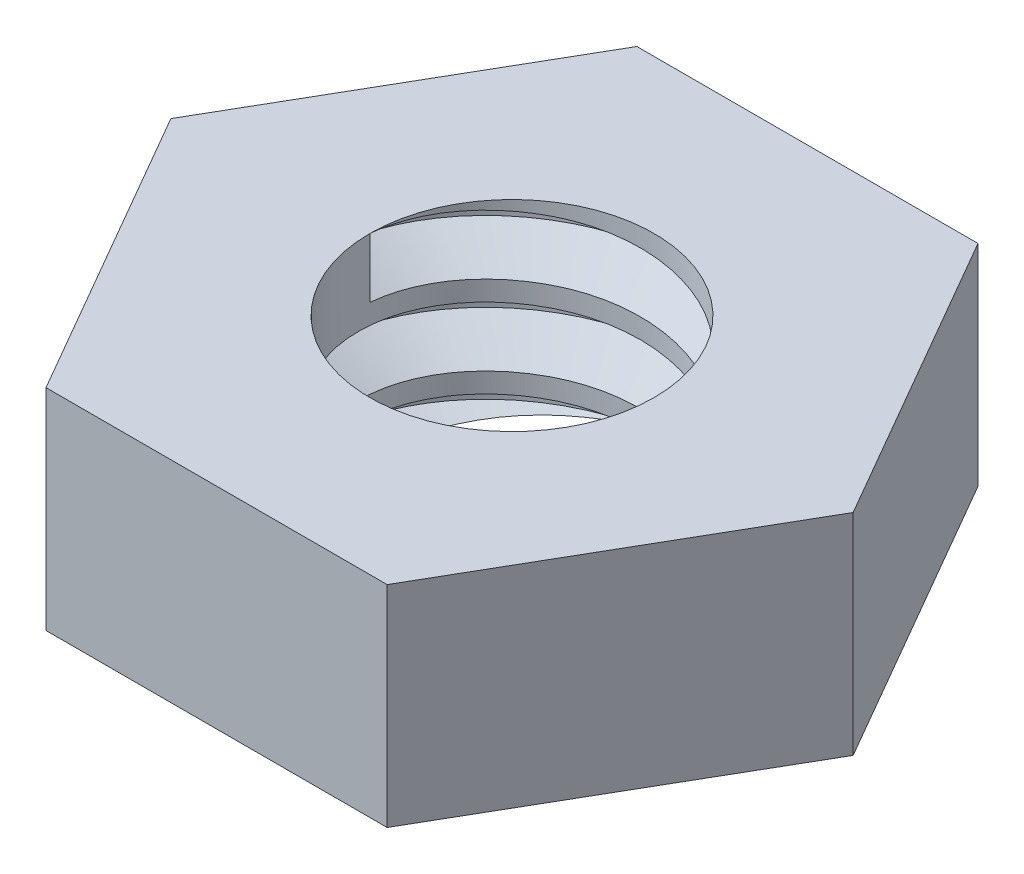
from build123d import *

# Parameters (mm, degrees)
BOSS_EXTRUDE1_DEPTH = 1.85
SKETCH2_R           = 1.25
CUT_EXTRUDE1_DEPTH  = 1.85
THREAD1_PITCH       = 0.7


with BuildPart() as part:
    # Sketch1 → Boss-Extrude1 (new body)
    with BuildSketch(Plane(origin=(0, 0, 0), x_dir=(1, 0, 0), z_dir=(0, 1, 0))):
        Polygon((3, 0), (1.5, 2.598076211), (-1.5, 2.598076211), (-3, 0), (-1.5, -2.598076211), (1.5, -2.598076211), align=None)
    extrude(amount=BOSS_EXTRUDE1_DEPTH)

    # Sketch2 → Cut-Extrude1 (cut)
    with BuildSketch(Plane(origin=(0, 1.85, 0), x_dir=(1, 0, 0), z_dir=(0, 1, 0))):
        with Locations(Location((0, 0, 0), (0, 0, 270))):
            Circle(SKETCH2_R)
    extrude(amount=-CUT_EXTRUDE1_DEPTH, mode=Mode.SUBTRACT)

    # Thread1: the profile of Thread Profile1 profile screwed along a right-hand helix of 15.714286 turns, 6 arcs to a turn; built about Z, then put on its axis
    thread1_z = Axis((0, 0, 0), (0, 0, 1))
    thread1_corners = [(1.2497, 0, -0.000173205), (1.628886113, 0, 0.218749999), (1.628886113, 0, 0.306249999), (1.2497, 0, 0.525173203)]
    with BuildLine(mode=Mode.PRIVATE) as thread1_profile:
        Line(thread1_corners[0], thread1_corners[1])
        Line(thread1_corners[1], thread1_corners[2])
        Line(thread1_corners[2], thread1_corners[3])
        Line(thread1_corners[3], thread1_corners[0])
    thread1_cap = Face(thread1_profile.wire())
    thread1_turn_angles = [0, 30, 60, 90, 120, 150, 180, 210, 240, 270, 300, 330, 360]
    thread1_turn_weights = [1, 0.8660254037844387, 1, 0.8660254037844387, 1, 0.8660254037844387, 1, 0.8660254037844387, 1, 0.8660254037844387, 1, 0.8660254037844387, 1]
    thread1_turn_rails = [Edge.make_bspline([Vector(p[0], p[1], 0).rotate(thread1_z, thread1_turn_angles[k]) / thread1_turn_weights[k] + Vector(0, 0, p[2] + THREAD1_PITCH * thread1_turn_angles[k] / 360) for k in range(13)], [0, 0, 0, 1, 1, 2, 2, 3, 3, 4, 4, 5, 5, 6, 6, 6], 2, thread1_turn_weights) for p in thread1_corners]
    thread1_turn_sides = [Face.make_surface_from_curves(thread1_turn_rails[p[0]], thread1_turn_rails[p[1]]) for p in [(0, 1), (1, 2), (2, 3), (3, 0)]]
    thread1_last_angles = [5400, 5430, 5460, 5490, 5520, 5550, 5580, 5610, 5640, 5648.571428571, 5657.142857143]
    thread1_last_weights = [1, 0.8660254037844387, 1, 0.8660254037844387, 1, 0.8660254037844387, 1, 0.8660254037844387, 1, 0.9888308262251277, 1]
    thread1_last_rails = [Edge.make_bspline([Vector(p[0], p[1], 0).rotate(thread1_z, thread1_last_angles[k]) / thread1_last_weights[k] + Vector(0, 0, p[2] + THREAD1_PITCH * thread1_last_angles[k] / 360) for k in range(11)], [0, 0, 0, 1, 1, 2, 2, 3, 3, 4, 4, 5, 5, 5], 2, thread1_last_weights) for p in thread1_corners]
    thread1_last_sides = [Face.make_surface_from_curves(thread1_last_rails[p[0]], thread1_last_rails[p[1]]) for p in [(0, 1), (1, 2), (2, 3), (3, 0)]]
    thread1 = Plane(origin=(0, 1.85, 0), x_dir=(-1, 0, 0), z_dir=(0, -1, 0)) * Solid(Shell([*[p.moved(Location((0, 0, THREAD1_PITCH * i))) for i in range(15) for p in thread1_turn_sides], *thread1_last_sides, thread1_cap, thread1_cap.rotate(thread1_z, 5657.142857143).moved(Location((0, 0, THREAD1_PITCH * 5657.142857143 / 360)))]))
    add(thread1, mode=Mode.SUBTRACT)


solid = part.part
